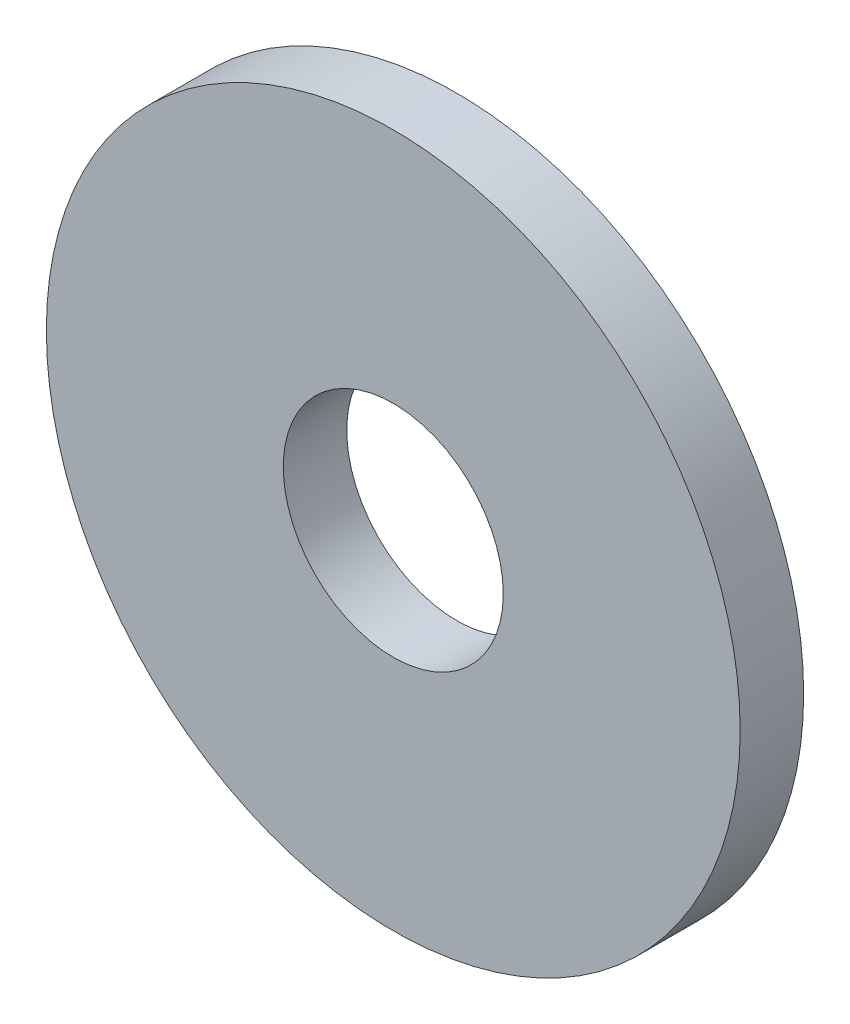
from build123d import *

# Parameters (mm, degrees)
SKICA1_R                = 16.4
SKICA1_R_2              = 5.2
P_IDAT_VYSUNUT_M1_DEPTH = 3


with BuildPart() as part:
    # Skica1 → Přidat vysunutím1 (new body)
    with BuildSketch(Plane.XY):
        Circle(SKICA1_R)
        Circle(SKICA1_R_2, mode=Mode.SUBTRACT)
    extrude(amount=P_IDAT_VYSUNUT_M1_DEPTH)


solid = part.part
